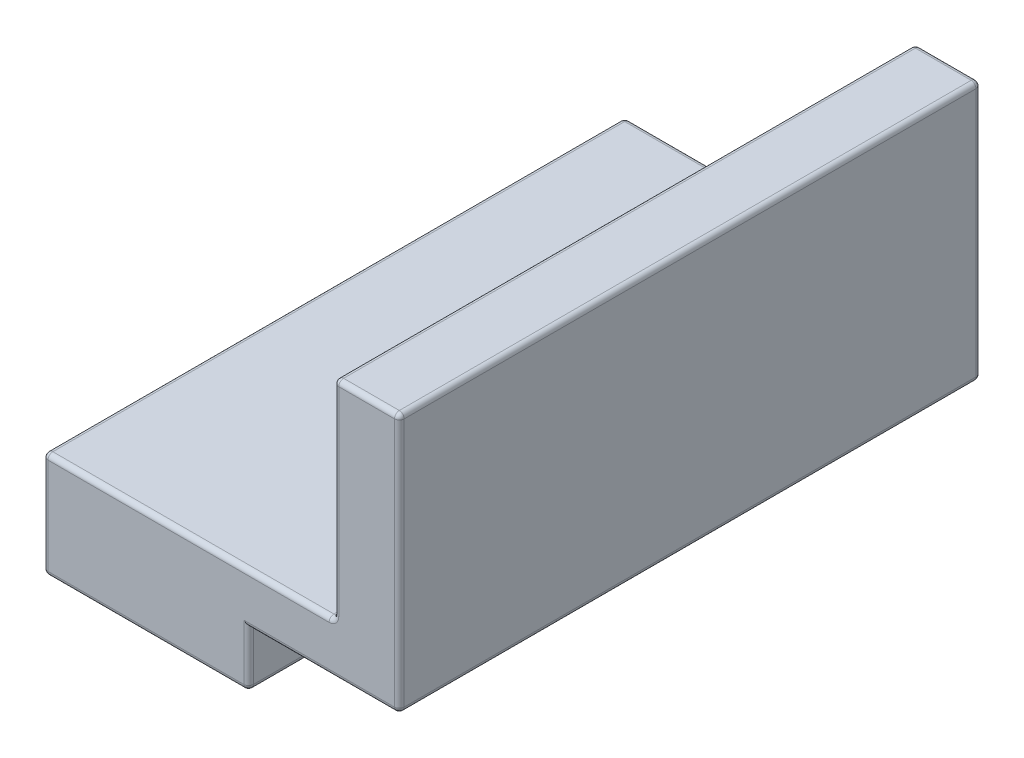
from build123d import *

# Parameters (mm, degrees)
BOSS_EXTRUDE1_DEPTH = 1200
CUT_EXTRUDE1_REACH  = 1552.073
SKETCH3_W           = 311
SKETCH3_H           = 115
SKETCH2_W           = 1160
SKETCH2_H           = 178.8
CUT_EXTRUDE2_DEPTH  = 310
SKETCH4_W           = 1160
SKETCH4_H           = 60
CUT_EXTRUDE3_DEPTH  = 280
FILLET2_R           = 10
FILLET3_R           = 2


with BuildPart() as part:
    # Sketch1 → Boss-Extrude1 (new body)
    with BuildSketch(Plane.XY):
        Polygon((0, 0), (735, 0), (735, 650), (600, 650), (600, 218.8), (0, 218.8), align=None)
    extrude(amount=BOSS_EXTRUDE1_DEPTH)

    # Sketch3 → Cut-Extrude1 (cut, up to next)
    with BuildSketch(Plane(origin=(0, 0, 0), x_dir=(-1, 0, 0), z_dir=(0, 0, -1)), mode=Mode.PRIVATE) as cut_extrude1_sk1:
        with Locations((-579.5, 57.5)):
            Rectangle(SKETCH3_W, SKETCH3_H)
    cut_extrude1_tool1 = extrude(cut_extrude1_sk1.sketch, amount=-CUT_EXTRUDE1_REACH, mode=Mode.PRIVATE) & part.part
    add(cut_extrude1_tool1.solids().sort_by_distance((579.5, 57.5, 0))[0], mode=Mode.SUBTRACT)

    # Sketch2 → Cut-Extrude2 (cut)
    with BuildSketch(Plane.ZY):
        with Locations((600, 109.4)):
            Rectangle(SKETCH2_W, SKETCH2_H)
    extrude(amount=-CUT_EXTRUDE2_DEPTH, mode=Mode.SUBTRACT)

    # Sketch4 → Cut-Extrude3 (cut)
    with BuildSketch(Plane.ZY.offset(-310)):
        with Locations((600, 168.8)):
            Rectangle(SKETCH4_W, SKETCH4_H)
    extrude(amount=-CUT_EXTRUDE3_DEPTH, mode=Mode.SUBTRACT)

    # Fillet2
    fillet2_edges = [part.edges().sort_by_distance(p)[0] for p in [
        (600, 434.4, 1200),
        (212, 0, 1200),
        (579.5, 115, 1200),
        (424, 57.5, 1200),
        (424, 0, 600),
        (212, 0, 0),
        (424, 57.5, 0),
        (735, 115, 600),
        (579.5, 115, 0),
        (735, 382.5, 0),
        (735, 382.5, 1200),
        (735, 650, 600),
        (667.5, 650, 0),
        (667.5, 650, 1200),
        (600, 650, 600),
        (300, 218.8, 1200),
        (600, 218.8, 600),
        (600, 434.4, 0),
        (300, 218.8, 0),
        (0, 109.4, 1200),
        (0, 0, 600),
        (0, 109.4, 0),
        (0, 218.8, 600),
    ]]
    fillet(fillet2_edges, radius=FILLET2_R)

    # Fillet3
    fillet3_edges = [part.edges().sort_by_distance(p)[0] for p in [
        (0, 109.4, 1180),
        (0, 20, 600),
        (0, 109.4, 20),
        (0, 198.8, 600),
        (295, 198.8, 1180),
        (295, 198.8, 20),
        (155, 20, 20),
        (155, 20, 1180),
    ]]
    fillet(fillet3_edges, radius=FILLET3_R)


solid = part.part
